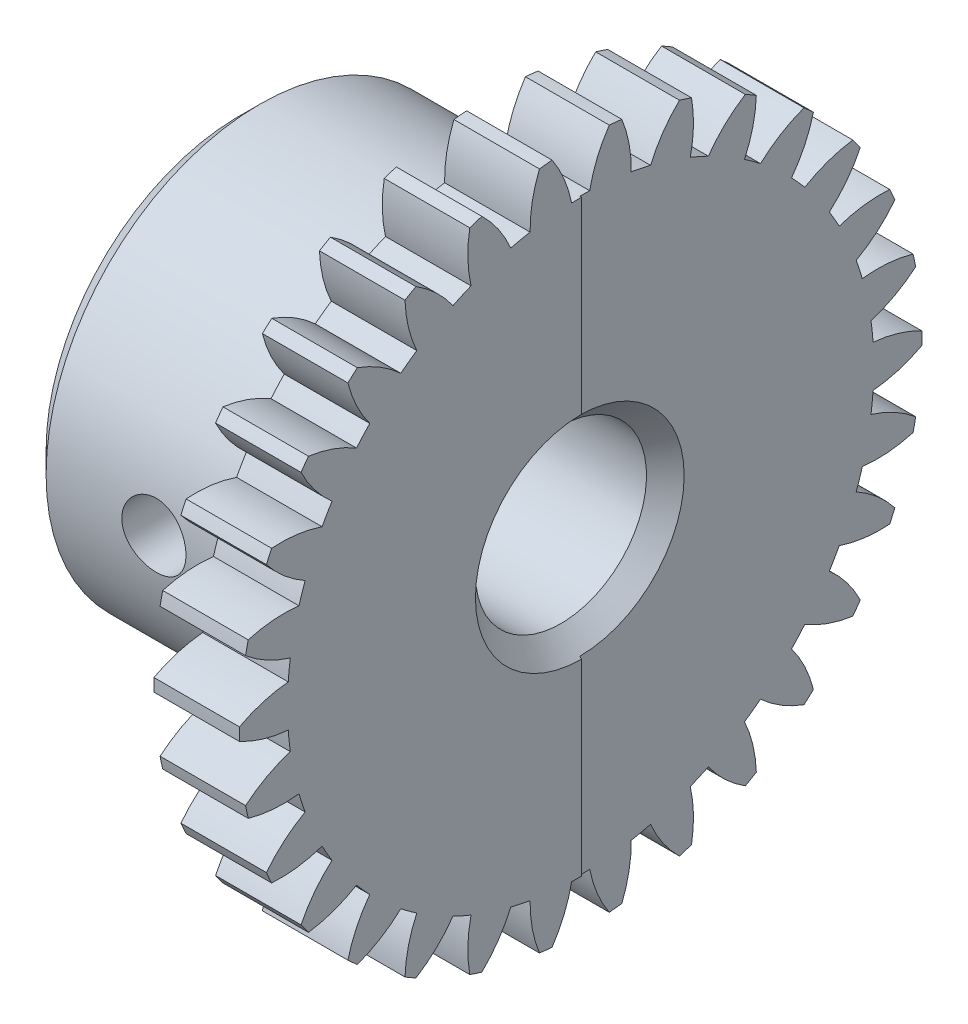
from build123d import *

# Parameters (mm, degrees)
BASPROSKE_W             = 6.35
BASPROSKE_H             = 25.4
TOOTHCUT_DEPTH          = 37.477972806
TEETHCUTS_COUNT         = 30
TEETHCUTS_ANGLE         = 348
HUBNEAONESKE_R          = 15.875
HUBNEARONE_DEPTH        = 19.0500508
BORSKE_R                = 6.35
BORE_DEPTH              = 25.4000508
CHAMFER1_SIZE           = 1.524
CHAMFER2_SIZE           = 1.524
CUT_EXTRUDE1_DEPTH      = 41.601023483
CUT_EXTRUDE1_DEPTH_BACK = 41.601023483
SKETCH1_R               = 2.38125
SKETCH2_W               = 32.229859927
SKETCH2_H               = 63.960998617
CUT_EXTRUDE2_DEPTH      = 0.127


with BuildPart() as part:
    # BasProSke → Base-Revolve (revolve)
    with BuildSketch(Plane(origin=(0, 0, 0), x_dir=(1, 0, 0), z_dir=(0, 1, 0))):
        with Locations((3.175, 12.7)):
            Rectangle(BASPROSKE_W, BASPROSKE_H)
    revolve(axis=Axis((-10, 0, 0), (1, 0, 0)))

    # TooCutSke → ToothCut (cut, through all)
    with BuildSketch(Plane(origin=(0, 0, 0), x_dir=(0, 0, -1), z_dir=(1, 0, 0))):
        with BuildLine():
            ThreePointArc((0.735377359, 21.814463535), (0, 21.826855), (-0.735377359, 21.814463535))
            ThreePointArc((-0.735377359, 21.814463535), (-1.291625993, 23.646238568), (-2.202933256, 25.329785831))
            ThreePointArc((-2.202933256, 25.329785831), (0, 25.4254), (2.202933256, 25.329785831))
            ThreePointArc((2.202933256, 25.329785831), (1.291625993, 23.646238568), (0.735377359, 21.814463535))
        make_face()
    toothcut = extrude(amount=TOOTHCUT_DEPTH, mode=Mode.SUBTRACT)

    # TeethCuts: ToothCut ×30 about axis
    teethcuts_axis = Axis((-10, 0, 0), (1, 0, 0))
    for i in range(1, TEETHCUTS_COUNT):
        add(toothcut.rotate(teethcuts_axis, i * TEETHCUTS_ANGLE / (TEETHCUTS_COUNT - 1)), mode=Mode.SUBTRACT)

    # HubNeaOneSke → HubNearOne (add)
    with BuildSketch(Plane.ZY):
        Circle(HUBNEAONESKE_R)
    extrude(amount=HUBNEARONE_DEPTH)

    # BorSke → Bore (cut, symmetric)
    with BuildSketch(Plane(origin=(0, 0, 0), x_dir=(0, 0, -1), z_dir=(1, 0, 0))):
        Circle(BORSKE_R)
    extrude(amount=BORE_DEPTH, both=True, mode=Mode.SUBTRACT)

    # Chamfer1
    chamfer1_edges = [part.edges().sort_by_distance(p)[0] for p in [
        (0, 0, -15.875),
        (-19.0500508, 0, -15.875),
    ]]
    chamfer(chamfer1_edges, length=CHAMFER1_SIZE)

    # Chamfer2
    chamfer2_edges = [part.edges().sort_by_distance(p)[0] for p in [
        (6.35, 0, 6.35),
        (-19.0500508, 0, 6.35),
    ]]
    chamfer(chamfer2_edges, length=CHAMFER2_SIZE)

    # Sketch1 → Cut-Extrude1 (cut, two sides: drawn at the far end of the back side and taken through both)
    with BuildSketch(Plane.XY.offset(-CUT_EXTRUDE1_DEPTH_BACK)):
        with Locations((-9.5250254, 0)):
            Circle(SKETCH1_R)
    extrude(amount=CUT_EXTRUDE1_DEPTH + CUT_EXTRUDE1_DEPTH_BACK, mode=Mode.SUBTRACT)

    # Sketch2 → Cut-Extrude2 (cut)
    with BuildSketch(Plane(origin=(6.35, 0, 0), x_dir=(0, 0, -1), z_dir=(1, 0, 0))):
        with Locations((16.114929963, 2.992327421)):
            Rectangle(SKETCH2_W, SKETCH2_H)
    extrude(amount=-CUT_EXTRUDE2_DEPTH, mode=Mode.SUBTRACT)


solid = part.part
